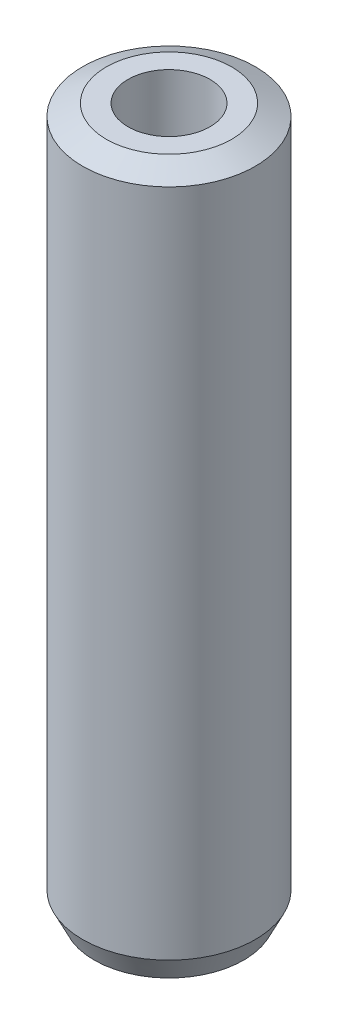
from build123d import *
from OCP.BRepFilletAPI import BRepFilletAPI_MakeChamfer

# Parameters (mm, degrees)
SKETCH1_R           = 7.5
BOSS_EXTRUDE1_DEPTH = 61.234998259
SKETCH2_R           = 3.565606803
CUT_EXTRUDE1_DEPTH  = 63.146802104
CHAMFER1_SIZE       = 1.005994755
CHAMFER1_SIZE2      = 2.053022554


with BuildPart() as part:
    # Sketch1 → Boss-Extrude1 (new body)
    with BuildSketch(Plane(origin=(0, 0, 0), x_dir=(1, 0, 0), z_dir=(0, 1, 0))):
        Circle(SKETCH1_R)
    extrude(amount=BOSS_EXTRUDE1_DEPTH)

    # Sketch2 → Cut-Extrude1 (cut, through all)
    with BuildSketch(Plane(origin=(0, 0, 0), x_dir=(1, 0, 0), z_dir=(0, 1, 0))):
        Circle(SKETCH2_R)
    extrude(amount=CUT_EXTRUDE1_DEPTH, mode=Mode.SUBTRACT)

    # Chamfer1: one chamfer whose edges measure the first distance from different faces: ONE call of the kernel's chamfer builder (chamfer() names one face for all edges)
    chamfer1_edges_1 = [part.edges().sort_by_distance(p)[0] for p in [
        (-7.5, 61.234998259, 0),
    ]]
    chamfer1_side_1 = [part.faces().sort_by_distance(p)[0] for p in [
        (-7.5, 30.617499129, 0),
    ]]
    chamfer1_edges_2 = [part.edges().sort_by_distance(p)[0] for p in [
        (-7.5, 0, 0),
    ]]
    chamfer1_side_2 = [part.faces().sort_by_distance(p)[0] for p in [
        (-7.287867966, 0, 0),
    ]]
    chamfer1 = BRepFilletAPI_MakeChamfer(part.part.solid().wrapped)
    for e in chamfer1_edges_1:
        chamfer1.Add(CHAMFER1_SIZE, CHAMFER1_SIZE2, e.wrapped, chamfer1_side_1[0].wrapped)  # the first distance lies on this face
    for e in chamfer1_edges_2:
        chamfer1.Add(CHAMFER1_SIZE, CHAMFER1_SIZE2, e.wrapped, chamfer1_side_2[0].wrapped)  # the first distance lies on this face
    add(Compound.cast(chamfer1.Shape()), mode=Mode.REPLACE)


solid = part.part
